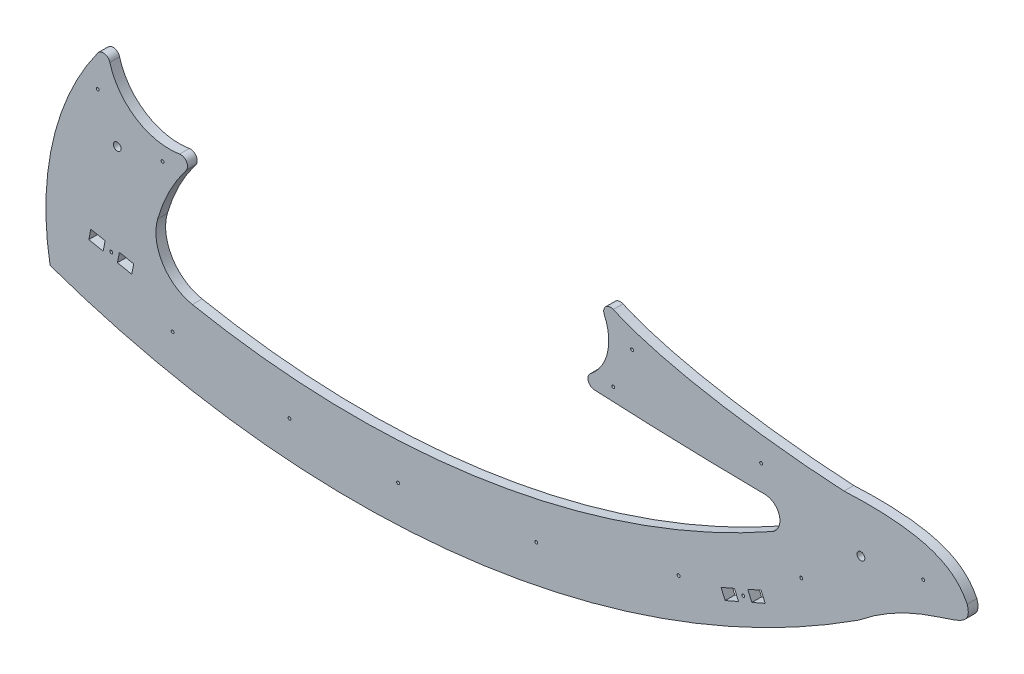
from build123d import *

# Parameters (mm, degrees)
EXTRUDE_3439_DEPTH      = 10
CUT_EXTRUDE_10781_REACH = 1083.261
SKETCH11_R              = 1.5
SKETCH11_R_2            = 4


with BuildPart() as part:
    # Sketch 384 → Extrude 3439 (new body)
    with BuildSketch(Plane.XY):
        with BuildLine():
            Line((398.785011417, -200.651493516), (-79.294784876, -202.700029576))
            add(Edge.make_bspline(
                [(-79.294784876, -202.700029576), (-78.517207033, -227.700030074), (-66.77413567, -249.709423293), (-44.177194857, -268.758733778)],
                knots=[0.130434783, 0.130434783, 0.130434783, 0.130434783, 0.173913043, 0.173913043, 0.173913043, 0.173913043], degree=3))
            add(Edge.make_bspline(
                [(-44.177194857, -268.758733778), (-12.705791537, -245.829015584), (38.959692419, -231.734357298), (82.666649693, -241.803965427)],
                knots=[0.173913043, 0.173913043, 0.173913043, 0.173913043, 0.217391304, 0.217391304, 0.217391304, 0.217391304], degree=3))
            add(Edge.make_bspline(
                [(82.666649693, -241.803965427), (105.678664452, -251.652519997), (111.246401119, -268.691898993), (94.211511027, -290.72343747)],
                knots=[0.217391304, 0.217391304, 0.217391304, 0.217391304, 0.260869565, 0.260869565, 0.260869565, 0.260869565], degree=3))
            add(Edge.make_bspline(
                [(94.211511027, -290.72343747), (87.158146802, -299.84568745), (74.983143168, -308.421687748), (61.059861243, -320.502125148)],
                knots=[0.260869565, 0.260869565, 0.260869565, 0.260869565, 0.304347826, 0.304347826, 0.304347826, 0.304347826], degree=3))
            add(Edge.make_bspline(
                [(61.059861243, -320.502125148), (47.380576162, -331.841195194), (34.883169502, -345.267804883), (22.870464668, -359.106695422)],
                knots=[0.304347826, 0.304347826, 0.304347826, 0.304347826, 0.347826087, 0.347826087, 0.347826087, 0.347826087], degree=3))
            add(Edge.make_bspline(
                [(22.870464668, -359.106695422), (-5.584395486, -391.889656597), (-25.592236503, -386.636342684), (-46.417157713, -376.787588607)],
                knots=[0.347826087, 0.347826087, 0.347826087, 0.347826087, 0.391304348, 0.391304348, 0.391304348, 0.391304348], degree=3))
            add(Edge.make_bspline(
                [(-46.417157713, -376.787588607), (-71.990241561, -366.221906762), (-92.784039707, -356.68149048), (-112.974728727, -345.609360564)],
                knots=[0.391304348, 0.391304348, 0.391304348, 0.391304348, 0.434782609, 0.434782609, 0.434782609, 0.434782609], degree=3))
            ThreePointArc((-112.974728727, -345.609360564), (-147.291018167, -331.50605668), (-183.878601839, -325.353039337))
            ThreePointArc((-183.878601839, -325.353039337), (-234.41691777, -376.347060605), (-177.788935429, -420.480757462))
            ThreePointArc((-177.788935429, -420.480757462), (-128.557787466, -442.172804122), (-130.703269603, -495.928247794))
            ThreePointArc((-130.703269603, -495.928247794), (-178.505297895, -598.929354982), (-181.694355183, -712.437468808))
            ThreePointArc((-181.694355183, -712.437468808), (245.849512772, -759.184021524), (650.190442214, -612.598169561))
            add(Edge.make_bspline(
                [(650.190442214, -612.598169561), (721.726306985, -555.13661338), (771.374178439, -572.802842814), (761.971022851, -542.438303349)],
                knots=[0.695652174, 0.695652174, 0.695652174, 0.695652174, 0.739130435, 0.739130435, 0.739130435, 0.739130435], degree=3))
            add(Edge.make_bspline(
                [(761.971022851, -542.438303349), (749.988144288, -518.251093648), (723.103402832, -500.836242812), (635.239899657, -505.006434182)],
                knots=[0.739130435, 0.739130435, 0.739130435, 0.739130435, 0.782608696, 0.782608696, 0.782608696, 0.782608696], degree=3))
            add(Edge.make_bspline(
                [(635.239899657, -505.006434182), (572.991975282, -501.932832065), (433.550272387, -486.778792548), (380.910397107, -452.903731023)],
                knots=[0.782608696, 0.782608696, 0.782608696, 0.782608696, 0.826086957, 0.826086957, 0.826086957, 0.826086957], degree=3))
            add(Edge.make_bspline(
                [(380.910397107, -452.903731023), (364.765905966, -442.514313456), (356.786231562, -430.363849161), (361.702578451, -416.260911342)],
                knots=[0.826086957, 0.826086957, 0.826086957, 0.826086957, 0.869565217, 0.869565217, 0.869565217, 0.869565217], degree=3))
            add(Edge.make_bspline(
                [(361.702578451, -416.260911342), (369.757666434, -319.561849491), (455.747401527, -287.137003064), (480.242749516, -200.302456329)],
                knots=[0.869565217, 0.869565217, 0.869565217, 0.869565217, 0.913043478, 0.913043478, 0.913043478, 0.913043478], degree=3))
            add(Edge.make_bspline(
                [(480.242749516, -200.302456329), (553.544349425, -5.601453319), (495.010045056, 115.276837959), (568.085803242, 187.174308847)],
                knots=[0.913043478, 0.913043478, 0.913043478, 0.913043478, 0.956521739, 0.956521739, 0.956521739, 0.956521739], degree=3))
            ThreePointArc((568.085803242, 187.174308847), (593.606841589, 203.592061702), (604.925253944, 231.748047725))
            ThreePointArc((604.925253944, 231.748047725), (600.64196866, 247.878688747), (587.30163028, 257.907621119))
            ThreePointArc((587.30163028, 257.907621119), (571.737485415, 260.097118561), (556.344046154, 256.922448156))
            add(Edge.make_bspline(
                [(556.344046154, 256.922448156), (413.493143177, 200.699964154), (492.80385804, -30.446360595), (410.726691822, -175.599321984)],
                knots=[0.000400641, 0.000400641, 0.000400641, 0.000400641, 0.043478261, 0.043478261, 0.043478261, 0.043478261], degree=3))
            add(Edge.make_bspline(
                [(410.726691822, -175.599321984), (407.231033021, -184.649150987), (403.219250068, -192.928185379), (398.785011417, -200.651493516)],
                knots=[0.043478261, 0.043478261, 0.043478261, 0.043478261, 0.086956522, 0.086956522, 0.086956522, 0.086956522], degree=3))
        make_face()
        with BuildLine():
            ThreePointArc((23.550736383, -511.142298049), (288.089199306, -537.834330314), (553.751503672, -548.632616793))
            ThreePointArc((553.751503672, -548.632616793), (568.814439244, -560.451490312), (561.291741423, -578.057932791))
            ThreePointArc((561.291741423, -578.057932791), (271.57991755, -679.226513713), (-35.244735251, -674.063656808))
            ThreePointArc((-35.244735251, -674.063656808), (-65.969287074, -652.699808002), (-70.986403303, -615.615570579))
            ThreePointArc((-70.986403303, -615.615570579), (-41.568101768, -557.565567627), (7.211162456, -514.486307076))
            ThreePointArc((7.211162456, -514.486307076), (15.100477301, -511.443853236), (23.550736383, -511.142298049))
        make_face(mode=Mode.SUBTRACT)
        with BuildLine():
            add(Edge.make_bspline(
                [(97.461776435, -368.948566513), (168.620673064, -296.351125936), (255.441952596, -250.089184531), (374.508522413, -234.330838847)],
                knots=[0.75, 0.75, 0.75, 0.75, 1, 1, 1, 1], degree=3))
            add(Edge.make_bspline(
                [(374.508522413, -234.330838847), (336.704373514, -278.003480948), (285.636212987, -310.964302456), (247.882738821, -396.645799506)],
                knots=[0, 0, 0, 0, 0.25, 0.25, 0.25, 0.25], degree=3))
            add(Edge.make_bspline(
                [(247.882738821, -396.645799506), (222.475445143, -441.097914765), (152.691350033, -451.719558275), (92.090753497, -427.546413805)],
                knots=[0.25, 0.25, 0.25, 0.25, 0.5, 0.5, 0.5, 0.5], degree=3))
            add(Edge.make_bspline(
                [(92.090753497, -427.546413805), (69.794668972, -412.531131284), (70.490548771, -396.456667038), (97.461776435, -368.948566513)],
                knots=[0.5, 0.5, 0.5, 0.5, 0.75, 0.75, 0.75, 0.75], degree=3))
        make_face(mode=Mode.SUBTRACT)
    extrude(amount=EXTRUDE_3439_DEPTH)

    # Sketch11 → Cut-Extrude 10781 (cut, up to next)
    with BuildSketch(Plane.XY.offset(10), mode=Mode.PRIVATE) as cut_extrude_10781_sk1:
        with Locations((-118.7617531, -668.979567573)):
            Circle(SKETCH11_R)
    cut_extrude_10781_tool1 = extrude(cut_extrude_10781_sk1.sketch, amount=-CUT_EXTRUDE_10781_REACH, mode=Mode.PRIVATE) & part.part
    # Sketch11 → Cut-Extrude 10781 (cut, up to next)
    with BuildSketch(Plane.XY.offset(10), mode=Mode.PRIVATE) as cut_extrude_10781_sk2:
        with Locations((531.551481114, -650.112952006)):
            Circle(SKETCH11_R)
    cut_extrude_10781_tool2 = extrude(cut_extrude_10781_sk2.sketch, amount=-CUT_EXTRUDE_10781_REACH, mode=Mode.PRIVATE) & part.part
    # Sketch11 → Cut-Extrude 10781 (cut, up to next)
    with BuildSketch(Plane.XY.offset(10), mode=Mode.PRIVATE) as cut_extrude_10781_sk3:
        with Locations((-112.549196195, -571.92123641)):
            Circle(SKETCH11_R_2)
    cut_extrude_10781_tool3 = extrude(cut_extrude_10781_sk3.sketch, amount=-CUT_EXTRUDE_10781_REACH, mode=Mode.PRIVATE) & part.part
    # Sketch11 → Cut-Extrude 10781 (cut, up to next)
    with BuildSketch(Plane.XY.offset(10), mode=Mode.PRIVATE) as cut_extrude_10781_sk4:
        with Locations((652.658313408, -554.355326316)):
            Circle(SKETCH11_R_2)
    cut_extrude_10781_tool4 = extrude(cut_extrude_10781_sk4.sketch, amount=-CUT_EXTRUDE_10781_REACH, mode=Mode.PRIVATE) & part.part
    # Sketch11 → Cut-Extrude 10781 (cut, up to next)
    with BuildSketch(Plane.XY.offset(10), mode=Mode.PRIVATE) as cut_extrude_10781_sk5:
        with Locations((-55.629283309, -708.500862393)):
            Circle(SKETCH11_R)
    cut_extrude_10781_tool5 = extrude(cut_extrude_10781_sk5.sketch, amount=-CUT_EXTRUDE_10781_REACH, mode=Mode.PRIVATE) & part.part
    # Sketch11 → Cut-Extrude 10781 (cut, up to next)
    with BuildSketch(Plane.XY.offset(10), mode=Mode.PRIVATE) as cut_extrude_10781_sk6:
        with Locations((64.612140699, -725.602608911)):
            Circle(SKETCH11_R)
    cut_extrude_10781_tool6 = extrude(cut_extrude_10781_sk6.sketch, amount=-CUT_EXTRUDE_10781_REACH, mode=Mode.PRIVATE) & part.part
    # Sketch11 → Cut-Extrude 10781 (cut, up to next)
    with BuildSketch(Plane.XY.offset(10), mode=Mode.PRIVATE) as cut_extrude_10781_sk7:
        with Locations((176.368279192, -727.095308066)):
            Circle(SKETCH11_R)
    cut_extrude_10781_tool7 = extrude(cut_extrude_10781_sk7.sketch, amount=-CUT_EXTRUDE_10781_REACH, mode=Mode.PRIVATE) & part.part
    # Sketch11 → Cut-Extrude 10781 (cut, up to next)
    with BuildSketch(Plane.XY.offset(10), mode=Mode.PRIVATE) as cut_extrude_10781_sk8:
        with Locations((318.582103721, -708.992706424)):
            Circle(SKETCH11_R)
    cut_extrude_10781_tool8 = extrude(cut_extrude_10781_sk8.sketch, amount=-CUT_EXTRUDE_10781_REACH, mode=Mode.PRIVATE) & part.part
    # Sketch11 → Cut-Extrude 10781 (cut, up to next)
    with BuildSketch(Plane.XY.offset(10), mode=Mode.PRIVATE) as cut_extrude_10781_sk9:
        with Locations((465.030751942, -665.430212723)):
            Circle(SKETCH11_R)
    cut_extrude_10781_tool9 = extrude(cut_extrude_10781_sk9.sketch, amount=-CUT_EXTRUDE_10781_REACH, mode=Mode.PRIVATE) & part.part
    # Sketch11 → Cut-Extrude 10781 (cut, up to next)
    with BuildSketch(Plane.XY.offset(10), mode=Mode.PRIVATE) as cut_extrude_10781_sk10:
        with Locations((591.24424266, -604.481261172)):
            Circle(SKETCH11_R)
    cut_extrude_10781_tool10 = extrude(cut_extrude_10781_sk10.sketch, amount=-CUT_EXTRUDE_10781_REACH, mode=Mode.PRIVATE) & part.part
    # Sketch11 → Cut-Extrude 10781 (cut, up to next)
    with BuildSketch(Plane.XY.offset(10), mode=Mode.PRIVATE) as cut_extrude_10781_sk11:
        with Locations((-132.599910119, -530.800552985)):
            Circle(SKETCH11_R)
    cut_extrude_10781_tool11 = extrude(cut_extrude_10781_sk11.sketch, amount=-CUT_EXTRUDE_10781_REACH, mode=Mode.PRIVATE) & part.part
    # Sketch11 → Cut-Extrude 10781 (cut, up to next)
    with BuildSketch(Plane.XY.offset(10), mode=Mode.PRIVATE) as cut_extrude_10781_sk12:
        with Locations((-65.903067652, -561.840964279)):
            Circle(SKETCH11_R)
    cut_extrude_10781_tool12 = extrude(cut_extrude_10781_sk12.sketch, amount=-CUT_EXTRUDE_10781_REACH, mode=Mode.PRIVATE) & part.part
    # Sketch11 → Cut-Extrude 10781 (cut, up to next)
    with BuildSketch(Plane.XY.offset(10), mode=Mode.PRIVATE) as cut_extrude_10781_sk13:
        with Locations((417.139992251, -488.069555791)):
            Circle(SKETCH11_R)
    cut_extrude_10781_tool13 = extrude(cut_extrude_10781_sk13.sketch, amount=-CUT_EXTRUDE_10781_REACH, mode=Mode.PRIVATE) & part.part
    # Sketch11 → Cut-Extrude 10781 (cut, up to next)
    with BuildSketch(Plane.XY.offset(10), mode=Mode.PRIVATE) as cut_extrude_10781_sk14:
        with Locations((397.83398583, -530.800552985)):
            Circle(SKETCH11_R)
    cut_extrude_10781_tool14 = extrude(cut_extrude_10781_sk14.sketch, amount=-CUT_EXTRUDE_10781_REACH, mode=Mode.PRIVATE) & part.part
    # Sketch11 → Cut-Extrude 10781 (cut, up to next)
    with BuildSketch(Plane.XY.offset(10), mode=Mode.PRIVATE) as cut_extrude_10781_sk15:
        with Locations((549.94258642, -522.830105286)):
            Circle(SKETCH11_R)
    cut_extrude_10781_tool15 = extrude(cut_extrude_10781_sk15.sketch, amount=-CUT_EXTRUDE_10781_REACH, mode=Mode.PRIVATE) & part.part
    # Sketch11 → Cut-Extrude 10781 (cut, up to next)
    with BuildSketch(Plane.XY.offset(10), mode=Mode.PRIVATE) as cut_extrude_10781_sk16:
        with Locations((716.702142537, -543.293994414)):
            Circle(SKETCH11_R)
    cut_extrude_10781_tool16 = extrude(cut_extrude_10781_sk16.sketch, amount=-CUT_EXTRUDE_10781_REACH, mode=Mode.PRIVATE) & part.part
    # Sketch11 → Cut-Extrude 10781 (cut, up to next)
    with BuildSketch(Plane.XY.offset(10), mode=Mode.PRIVATE) as cut_extrude_10781_sk17:
        with BuildLine():
            Line((-41.705819007, -557.743910724), (378.372578497, -543.293994414))
            ThreePointArc((378.372578497, -543.293994414), (372.053510252, -538.425615559), (374.396618638, -530.800552985))
            ThreePointArc((374.396618638, -530.800552985), (391.866955364, -503.505455385), (388.609357998, -471.262268854))
            ThreePointArc((388.609357998, -471.262268854), (389.976227464, -463.387681665), (397.83398583, -461.92717183))
            ThreePointArc((397.83398583, -461.92717183), (420.365583823, -447.935833433), (445.129837883, -438.440456708))
            Line((445.129837883, -438.440456708), (806.492768263, -337.898743925))
            Line((806.492768263, -337.898743925), (641.901405555, 366.465206509))
            Line((641.901405555, 366.465206509), (-477.319818058, -249.120713749))
            Line((-477.319818058, -249.120713749), (-132.599910119, -498.518549796))
            ThreePointArc((-132.599910119, -498.518549796), (-125.690057824, -495.732100316), (-120.183240588, -500.750598434))
            ThreePointArc((-120.183240588, -500.750598434), (-93.070343529, -537.418730172), (-48.39331735, -546.563368155))
            ThreePointArc((-48.39331735, -546.563368155), (-41.241618936, -549.87596337), (-41.705819007, -557.743910724))
        make_face()
    cut_extrude_10781_tool17 = extrude(cut_extrude_10781_sk17.sketch, amount=-CUT_EXTRUDE_10781_REACH, mode=Mode.PRIVATE) & part.part
    # Sketch11 → Cut-Extrude 10781 (cut, up to next)
    with BuildSketch(Plane.XY.offset(10), mode=Mode.PRIVATE) as cut_extrude_10781_sk18:
        Polygon((-127.095949816, -672.413394171), (-141.805292897, -669.474818645), (-139.748290029, -659.178278488), (-125.038946948, -662.116854014), align=None)
    cut_extrude_10781_tool18 = extrude(cut_extrude_10781_sk18.sketch, amount=-CUT_EXTRUDE_10781_REACH, mode=Mode.PRIVATE) & part.part
    # Sketch11 → Cut-Extrude 10781 (cut, up to next)
    with BuildSketch(Plane.XY.offset(10), mode=Mode.PRIVATE) as cut_extrude_10781_sk19:
        Polygon((-110.329603867, -665.055429539), (-95.620260785, -667.994005064), (-97.677263653, -678.290545221), (-112.386606734, -675.351969696), align=None)
    cut_extrude_10781_tool19 = extrude(cut_extrude_10781_sk19.sketch, amount=-CUT_EXTRUDE_10781_REACH, mode=Mode.PRIVATE) & part.part
    # Sketch11 → Cut-Extrude 10781 (cut, up to next)
    with BuildSketch(Plane.XY.offset(10), mode=Mode.PRIVATE) as cut_extrude_10781_sk20:
        Polygon((536.207900287, -642.062004206), (549.94258642, -636.032211769), (554.163441126, -645.646492062), (540.428754993, -651.676284499), align=None)
    cut_extrude_10781_tool20 = extrude(cut_extrude_10781_sk20.sketch, amount=-CUT_EXTRUDE_10781_REACH, mode=Mode.PRIVATE) & part.part
    # Sketch11 → Cut-Extrude 10781 (cut, up to next)
    with BuildSketch(Plane.XY.offset(10), mode=Mode.PRIVATE) as cut_extrude_10781_sk21:
        Polygon((512.959382727, -663.735869372), (508.738528021, -654.121589079), (522.473214154, -648.091796642), (526.69406886, -657.706076935), align=None)
    cut_extrude_10781_tool21 = extrude(cut_extrude_10781_sk21.sketch, amount=-CUT_EXTRUDE_10781_REACH, mode=Mode.PRIVATE) & part.part
    add(cut_extrude_10781_tool1.solids().sort_by_distance((-118.761753, -668.979568, 10))[0], mode=Mode.SUBTRACT)
    add(cut_extrude_10781_tool2.solids().sort_by_distance((531.551481, -650.112952, 10))[0], mode=Mode.SUBTRACT)
    add(cut_extrude_10781_tool3.solids().sort_by_distance((-112.549196, -571.921236, 10))[0], mode=Mode.SUBTRACT)
    add(cut_extrude_10781_tool4.solids().sort_by_distance((652.658313, -554.355326, 10))[0], mode=Mode.SUBTRACT)
    add(cut_extrude_10781_tool5.solids().sort_by_distance((-55.629283, -708.500862, 10))[0], mode=Mode.SUBTRACT)
    add(cut_extrude_10781_tool6.solids().sort_by_distance((64.612141, -725.602609, 10))[0], mode=Mode.SUBTRACT)
    add(cut_extrude_10781_tool7.solids().sort_by_distance((176.368279, -727.095308, 10))[0], mode=Mode.SUBTRACT)
    add(cut_extrude_10781_tool8.solids().sort_by_distance((318.582104, -708.992706, 10))[0], mode=Mode.SUBTRACT)
    add(cut_extrude_10781_tool9.solids().sort_by_distance((465.030752, -665.430213, 10))[0], mode=Mode.SUBTRACT)
    add(cut_extrude_10781_tool10.solids().sort_by_distance((591.244243, -604.481261, 10))[0], mode=Mode.SUBTRACT)
    add(cut_extrude_10781_tool11.solids().sort_by_distance((-132.59991, -530.800553, 10))[0], mode=Mode.SUBTRACT)
    add(cut_extrude_10781_tool12.solids().sort_by_distance((-65.903068, -561.840964, 10))[0], mode=Mode.SUBTRACT)
    add(cut_extrude_10781_tool13.solids().sort_by_distance((417.139992, -488.069556, 10))[0], mode=Mode.SUBTRACT)
    add(cut_extrude_10781_tool14.solids().sort_by_distance((397.833986, -530.800553, 10))[0], mode=Mode.SUBTRACT)
    add(cut_extrude_10781_tool15.solids().sort_by_distance((549.942586, -522.830105, 10))[0], mode=Mode.SUBTRACT)
    add(cut_extrude_10781_tool16.solids().sort_by_distance((716.702143, -543.293994, 10))[0], mode=Mode.SUBTRACT)
    add(cut_extrude_10781_tool17.solids().sort_by_distance((257.633652, -174.53125, 10))[0], mode=Mode.SUBTRACT)
    add(cut_extrude_10781_tool18.solids().sort_by_distance((-133.42212, -665.795836, 10))[0], mode=Mode.SUBTRACT)
    add(cut_extrude_10781_tool19.solids().sort_by_distance((-104.003434, -671.672987, 10))[0], mode=Mode.SUBTRACT)
    add(cut_extrude_10781_tool20.solids().sort_by_distance((545.185671, -643.854248, 10))[0], mode=Mode.SUBTRACT)
    add(cut_extrude_10781_tool21.solids().sort_by_distance((517.716298, -655.913833, 10))[0], mode=Mode.SUBTRACT)


solid = part.part
